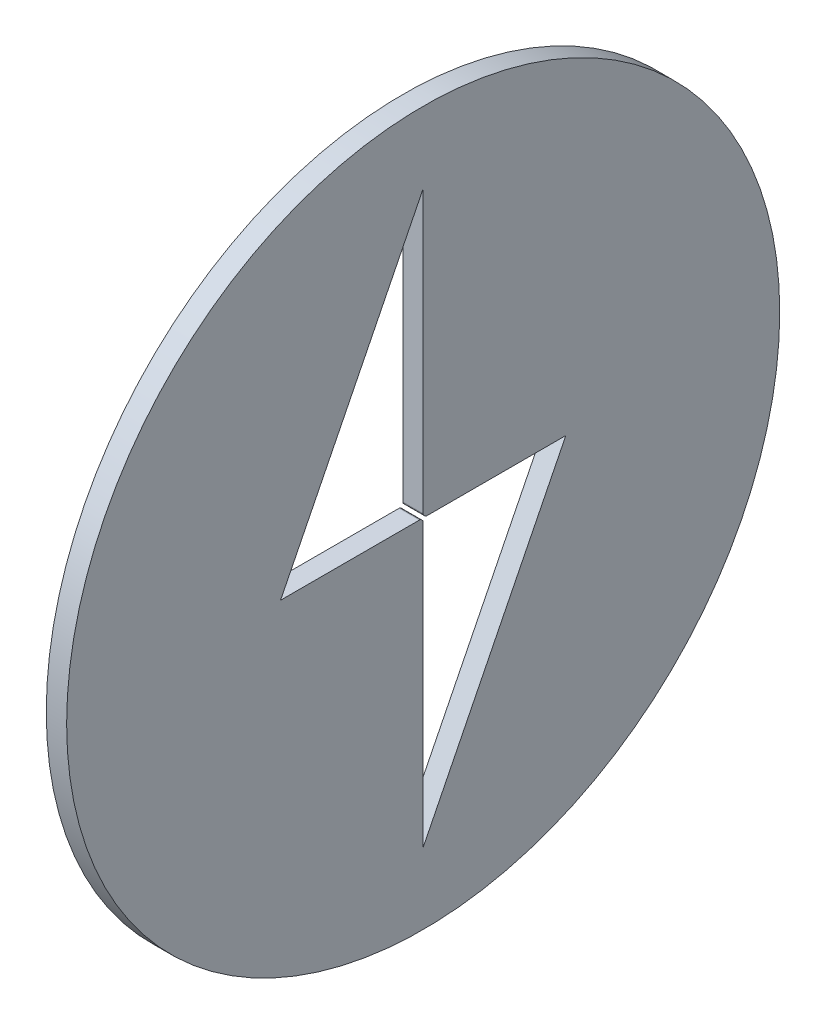
from build123d import *

# Parameters (mm, degrees)
SKETCH1_W               = 85
SKETCH1_H               = 200
BOSS_EXTRUDE1_DEPTH     = 5
FILLET1_R               = 1
SKETCH2_R               = 17.5
CUT_EXTRUDE1_DEPTH      = 2.5
FILLET2_R               = 0.125
SKETCH3_W               = 15
SKETCH3_H               = 85
BOSS_EXTRUDE2_DEPTH     = 3
RIB1_START              = -5
RIB1_DEPTH              = 5
SKETCH5_R               = 1.5
CUT_EXTRUDE2_DEPTH      = 3
FILLET3_R               = 4
FILLET4_R               = 3
SKETCH6_OUTSIDE_W       = 130.646
SKETCH6_OUTSIDE_H       = 245.646
SKETCH6_OUTSIDE_R       = 17.5
CUT_EXTRUDE4_DEPTH      = 206.441597541
CUT_EXTRUDE5_DEPTH      = 194.642389471
CUT_EXTRUDE5_DEPTH_BACK = 194.642389471
CUT_EXTRUDE6_START      = -1.5
SKETCH9_R               = 17.5
CUT_EXTRUDE6_DEPTH      = 1.5


# Read off the part's stored shape, not the designer's step: Rib1
with BuildPart() as part:
    # Sketch1 → Boss-Extrude1 (new body)
    with BuildSketch(Plane(origin=(0, 0, 0), x_dir=(0, 0, -1), z_dir=(1, 0, 0))):
        with Locations((0, 100)):
            Rectangle(SKETCH1_W, SKETCH1_H)
        Polygon((-16, 25), (-16, 176), (-11, 176), (-11, 49), (-7, 49), (-7, 29), (-2.5, 29), (-2.5, 42), (16, 42), (16, 25), (16, 24), (15, 24), (-15, 24), (-16, 24), align=None, mode=Mode.SUBTRACT)
    extrude(amount=BOSS_EXTRUDE1_DEPTH)

    # Fillet1
    fillet1_edges = [part.edges().sort_by_distance(p)[0] for p in [
        (2.5, 42, 2.5),
        (2.5, 29, 2.5),
        (2.5, 29, 7),
        (2.5, 49, 11),
    ]]
    fillet(fillet1_edges, radius=FILLET1_R)

    # Sketch2 → Cut-Extrude1 (cut)
    with BuildSketch(Plane(origin=(5, 0, 0), x_dir=(0, 0, -1), z_dir=(1, 0, 0))):
        with Locations((15.75, 173.25)):
            Circle(SKETCH2_R)
        Polygon((15.75, 173.125), (15.625, 173.25), (8.75, 173.25), (15.75, 187.25), (15.75, 173.375), (15.875, 173.25), (22.75, 173.25), (15.75, 159.25), align=None, mode=Mode.SUBTRACT)
    extrude(amount=-CUT_EXTRUDE1_DEPTH, mode=Mode.SUBTRACT)

    # Fillet2
    fillet2_edges = [part.edges().sort_by_distance(p)[0] for p in [
        (3.75, 173.25, -15.625),
        (3.75, 173.125, -15.75),
        (3.75, 173.25, -15.875),
        (3.75, 173.375, -15.75),
    ]]
    fillet(fillet2_edges, radius=FILLET2_R)

    # Sketch3 → Boss-Extrude2 (add)
    with BuildSketch(Plane.XZ):
        with Locations((-7.5, 0)):
            Rectangle(SKETCH3_W, SKETCH3_H)
    extrude(amount=-BOSS_EXTRUDE2_DEPTH)

    # Rib1 outline → Rib1 (add)
    with BuildSketch(Plane.XY.offset(42.5).offset(RIB1_START)):
        Polygon((0, 18), (-15, 3), (0, 3), align=None)
    rib1 = extrude(amount=RIB1_DEPTH)

    # Mirror1: Rib1 across plane
    add(rib1.mirror(Plane.XY))

    # Sketch5 → Cut-Extrude2 (cut)
    with BuildSketch(Plane(origin=(0, 3, 0), x_dir=(1, 0, 0), z_dir=(0, 1, 0))):
        with Locations(Location((-7.5, 24.5, 0), (0, 0, 270))):
            Circle(SKETCH5_R)
        with Locations(Location((-7.5, 0, 0), (0, 0, 270))):
            Circle(SKETCH5_R)
        with Locations(Location((-7.5, -24.5, 0), (0, 0, 270))):
            Circle(SKETCH5_R)
    extrude(amount=-CUT_EXTRUDE2_DEPTH, mode=Mode.SUBTRACT)

    # Fillet3
    fillet3_edges = [part.edges().sort_by_distance(p)[0] for p in [
        (0, 18, 40),
        (0, 18, -40),
    ]]
    fillet(fillet3_edges, radius=FILLET3_R)

    # Fillet4
    fillet4_edges = [part.edges().sort_by_distance(p)[0] for p in [
        (0, 3, 0),
    ]]
    fillet(fillet4_edges, radius=FILLET4_R)

    # Sketch6 outside → Cut-Extrude4 (cut, through all)
    with BuildSketch(Plane(origin=(5, 0, 0), x_dir=(0, 0, -1), z_dir=(1, 0, 0))):
        with Locations((0, 100)):
            Rectangle(SKETCH6_OUTSIDE_W, SKETCH6_OUTSIDE_H)
        with Locations((15.75, 173.25)):
            Circle(SKETCH6_OUTSIDE_R, mode=Mode.SUBTRACT)
    extrude(amount=-CUT_EXTRUDE4_DEPTH, mode=Mode.SUBTRACT)

    # Sketch7 → Cut-Extrude5 (cut, two sides: drawn at the far end of the back side and taken through both)
    with BuildSketch(Plane(origin=(2.5, 0, 0), x_dir=(0, 0, -1), z_dir=(1, 0, 0)).offset(-CUT_EXTRUDE5_DEPTH_BACK)):
        with BuildLine():
            Line((22.75, 173.25), (15.75, 159.25))
            Line((15.75, 159.25), (15.75, 173.073223305))
            ThreePointArc((15.75, 173.073223305), (15.740484942, 173.121058734), (15.713388348, 173.161611652))
            Line((15.713388348, 173.161611652), (15.661611652, 173.213388348))
            ThreePointArc((15.661611652, 173.213388348), (15.621058734, 173.240484942), (15.573223305, 173.25))
            Line((15.573223305, 173.25), (8.75, 173.25))
            Line((8.75, 173.25), (15.75, 187.25))
            Line((15.75, 187.25), (15.75, 173.426776695))
            ThreePointArc((15.75, 173.426776695), (15.759515058, 173.378941266), (15.786611652, 173.338388348))
            Line((15.786611652, 173.338388348), (15.838388348, 173.286611652))
            ThreePointArc((15.838388348, 173.286611652), (15.878941266, 173.259515058), (15.926776695, 173.25))
            Line((15.926776695, 173.25), (22.75, 173.25))
        make_face()
    extrude(amount=CUT_EXTRUDE5_DEPTH + CUT_EXTRUDE5_DEPTH_BACK, mode=Mode.SUBTRACT)

    # Sketch9 → Cut-Extrude6 (cut)
    with BuildSketch(Plane.ZY.offset(CUT_EXTRUDE6_START)):
        with Locations(Location((-15.75, 173.25, 0), (0, 0, 180))):
            Circle(SKETCH9_R)
    extrude(amount=CUT_EXTRUDE6_DEPTH, mode=Mode.SUBTRACT)


solid = part.part
